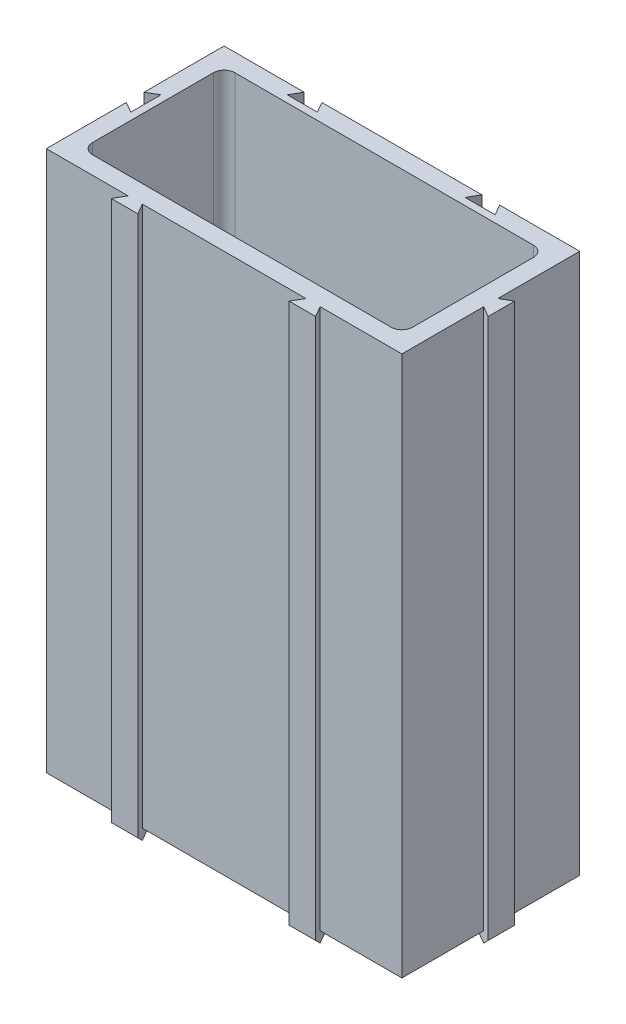
from build123d import *

# Parameters (mm, degrees)
BOSS_EXTRUDE1_DEPTH     = 77.5
SKETCH2_W               = 45
SKETCH2_H               = 20
BOSS_EXTRUDE2_DEPTH     = 2.5
CUT_EXTRUDE1_DEPTH      = 86.685471347
CUT_EXTRUDE1_DEPTH_BACK = 86.685471347
SKETCH3_R               = 1.5
CHAMFER3_SIZE           = 1.5
CHAMFER2_SIZE           = 1
FILLET1_R               = 1.5


with BuildPart() as part:
    # Sketch1 → Boss-Extrude1 (new body)
    with BuildSketch(Plane(origin=(0, 0, 0), x_dir=(1, 0, 0), z_dir=(0, 1, 0))):
        Polygon((12.5, -12.5), (1, -12.5), (1.866025404, -14), (-1.866025404, -14), (-1, -12.5), (-12.5, -12.5), (-12.5, -1.25), (-11, -2.116025404), (-11, 2.116025404), (-12.5, 1.25), (-12.5, 12.5), (-1.25, 12.5), (-2.116025404, 11), (2.116025404, 11), (1.25, 12.5), (12.5, 12.5), (23.75, 12.5), (22.883974596, 11), (27.116025404, 11), (26.25, 12.5), (37.5, 12.5), (37.5, 1), (39, 1.866025404), (39, -1.866025404), (37.5, -1), (37.5, -12.5), (26, -12.5), (26.866025404, -14), (23.133974596, -14), (24, -12.5), align=None)
        Polygon((15, -10), (35, -10), (35, 10), (15, 10), (10, 10), (-10, 10), (-10, -10), (10, -10), align=None, mode=Mode.SUBTRACT)
    extrude(amount=BOSS_EXTRUDE1_DEPTH)

    # Sketch2 → Boss-Extrude2 (add)
    with BuildSketch(Plane(origin=(0, 0, 0), x_dir=(1, 0, 0), z_dir=(0, 1, 0))):
        with Locations((12.5, 0)):
            Rectangle(SKETCH2_W, SKETCH2_H)
    extrude(amount=BOSS_EXTRUDE2_DEPTH)

    # Sketch3 → Cut-Extrude1 (cut, two sides: drawn at the far end of the back side and taken through both)
    with BuildSketch(Plane(origin=(0, 2.5, 0), x_dir=(1, 0, 0), z_dir=(0, 1, 0)).offset(-CUT_EXTRUDE1_DEPTH_BACK)):
        with Locations(Location((-6, 6, 0), (0, 0, 270))):
            Circle(SKETCH3_R)
        with Locations(Location((6, 6, 0), (0, 0, 270))):
            Circle(SKETCH3_R)
        with Locations(Location((6, -6, 0), (0, 0, 270))):
            Circle(SKETCH3_R)
        with Locations(Location((-6, -6, 0), (0, 0, 270))):
            Circle(SKETCH3_R)
        with Locations(Location((31, -6, 0), (0, 0, 270))):
            Circle(SKETCH3_R)
        with Locations(Location((19, -6, 0), (0, 0, 270))):
            Circle(SKETCH3_R)
        with Locations(Location((19, 6, 0), (0, 0, 270))):
            Circle(SKETCH3_R)
        with Locations(Location((31, 6, 0), (0, 0, 270))):
            Circle(SKETCH3_R)
    extrude(amount=CUT_EXTRUDE1_DEPTH + CUT_EXTRUDE1_DEPTH_BACK, mode=Mode.SUBTRACT)

    # Chamfer3
    chamfer3_edges = [part.edges().sort_by_distance(p)[0] for p in [
        (-11, 0, 0),
        (0, 0, 14),
        (25, 0, 14),
        (39, 0, 0),
        (0, 0, -11),
        (25, 0, -11),
        (-6.875, 0, -12.5),
        (-12.5, 0, -6.875),
        (-12.5, 0, 6.875),
        (-6.75, 0, 12.5),
        (12.5, 0, 12.5),
        (37.5, 0, 6.75),
        (31.75, 0, 12.5),
        (37.5, 0, -6.75),
        (31.875, 0, -12.5),
        (12.5, 0, -12.5),
    ]]
    chamfer(chamfer3_edges, length=CHAMFER3_SIZE - 0.0001)  # a hair under: the kernel refuses the full size

    # Chamfer2
    chamfer2_edges = [part.edges().sort_by_distance(p)[0] for p in [
        (12.5, 2.5, -10),
        (-10, 2.5, 0),
        (12.5, 2.5, 10),
        (35, 2.5, 0),
        (31, 2.5, 4.5),
        (-6, 2.5, 4.5),
        (6, 2.5, 4.5),
        (6, 2.5, -7.5),
        (19, 2.5, 4.5),
        (19, 2.5, -7.5),
        (31, 2.5, -7.5),
        (-6, 2.5, -7.5),
    ]]
    chamfer(chamfer2_edges, length=CHAMFER2_SIZE)

    # Fillet1
    fillet1_edges = [part.edges().sort_by_distance(p)[0] for p in [
        (35, 40.5, 10),
        (35, 40.5, -10),
        (-10, 40.5, -10),
        (-10, 40.5, 10),
    ]]
    fillet(fillet1_edges, radius=FILLET1_R)


solid = part.part
